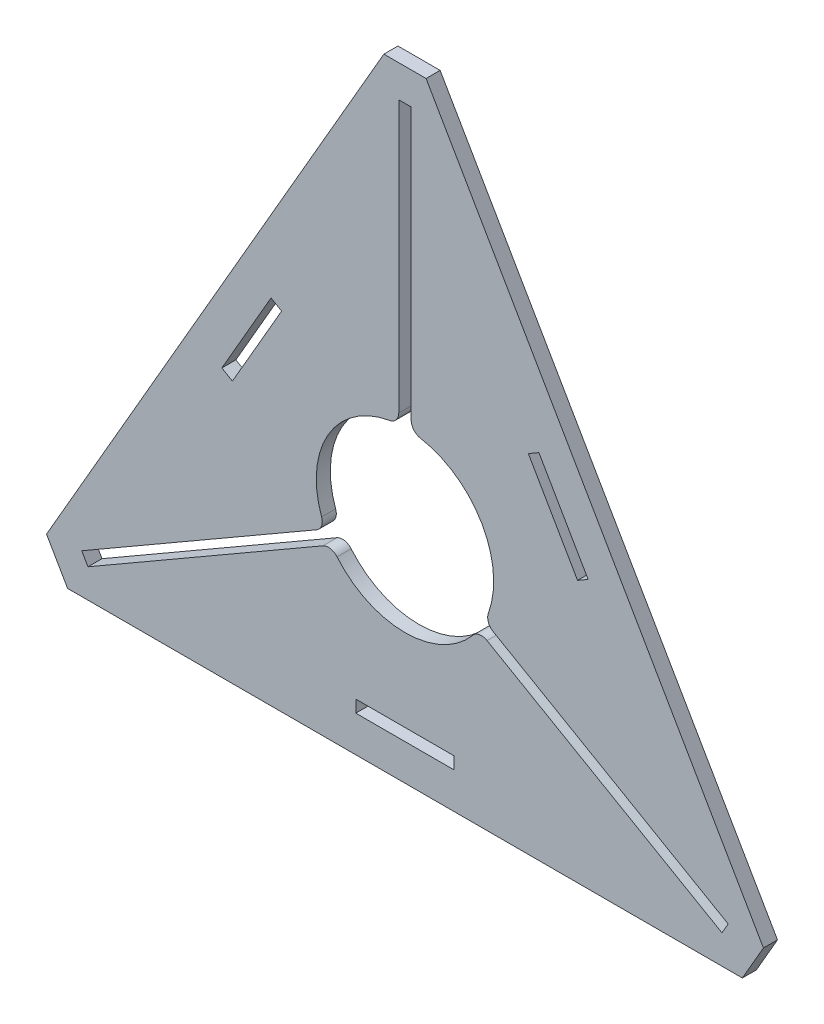
from build123d import *

# Parameters (mm, degrees)
SKETCH1_W           = 44.45
SKETCH1_H           = 5.5118
BOSS_EXTRUDE1_DEPTH = 6.35


with BuildPart() as part:
    # Sketch1 → Boss-Extrude1 (new body)
    with BuildSketch(Plane.XY):
        Polygon((0, -98.986703653), (152.4, -98.986703653), (161.925, -82.48891971), (9.525, 181.475623363), (-9.525, 181.475623363), (-161.925, -82.48891971), (-152.4, -98.986703653), align=None)
        with BuildLine():
            Line((-2.8067, 166.9700779), (2.8067, 166.9700779))
            Line((2.8067, 166.9700779), (2.8067, 44.454325047))
            ThreePointArc((2.8067, 44.454325047), (3.993478107, 41.191010276), (6.999307595, 39.452431933))
            ThreePointArc((6.999307595, 39.452431933), (34.700338892, 20.03425), (37.666462093, -13.66463778))
            ThreePointArc((37.666462093, -13.66463778), (37.66920036, -17.137051648), (39.901924799, -19.796489023))
            Line((39.901924799, -19.796489023), (146.003679134, -81.054365449))
            Line((146.003679134, -81.054365449), (143.196979134, -85.915712451))
            Line((143.196979134, -85.915712451), (37.095224799, -24.657836024))
            ThreePointArc((37.095224799, -24.657836024), (33.675722253, -24.053958628), (30.667154498, -25.787794153))
            ThreePointArc((30.667154498, -25.787794153), (0, -40.0685), (-30.667154498, -25.787794153))
            ThreePointArc((-30.667154498, -25.787794153), (-33.675722253, -24.053958628), (-37.095224799, -24.657836024))
            Line((-37.095224799, -24.657836024), (-143.196979134, -85.915712451))
            Line((-143.196979134, -85.915712451), (-146.003679134, -81.054365449))
            Line((-146.003679134, -81.054365449), (-39.901924799, -19.796489023))
            ThreePointArc((-39.901924799, -19.796489023), (-37.66920036, -17.137051648), (-37.666462093, -13.66463778))
            ThreePointArc((-37.666462093, -13.66463778), (-34.700338892, 20.03425), (-6.999307595, 39.452431933))
            ThreePointArc((-6.999307595, 39.452431933), (-3.993478107, 41.191010276), (-2.8067, 44.454325047))
            Line((-2.8067, 44.454325047), (-2.8067, 166.9700779))
        make_face(mode=Mode.SUBTRACT)
        with Locations((0, -79.936703653)):
            Rectangle(SKETCH1_W, SKETCH1_H, mode=Mode.SUBTRACT)
        Polygon((-82.726395468, 22.098887227), (-60.501395468, 60.593716425), (-55.728036648, 57.837816425), (-77.953036648, 19.342987227), align=None, mode=Mode.SUBTRACT)
        Polygon((60.501395468, 60.593716425), (55.728036648, 57.837816425), (77.953036648, 19.342987227), (82.726395468, 22.098887227), align=None, mode=Mode.SUBTRACT)
    extrude(amount=BOSS_EXTRUDE1_DEPTH)


solid = part.part
